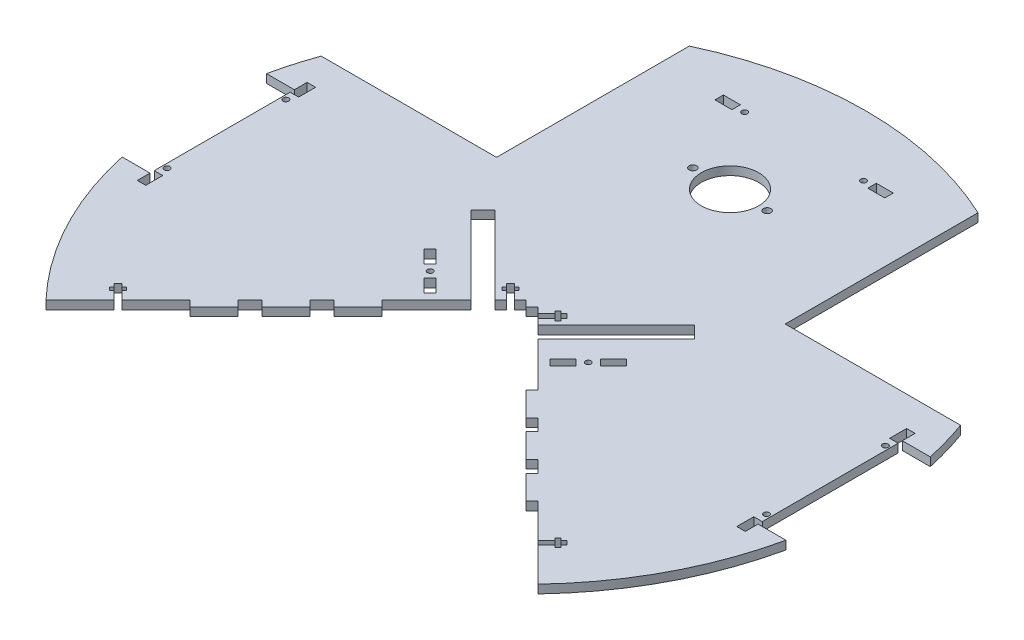
from build123d import *

# Parameters (mm, degrees)
SKETCH1_R                   = 254
BASE_PLATE_DEPTH            = 6.35
V_FUNNEL_CUT_DEPTH          = 360.266367059
SKETCH4_W                   = 26.67
SKETCH4_H                   = 107.95
WHEEL_HOLE_SLOT_DEPTH       = 360.266367059
SKETCH6_R                   = 2.0955
ARM_POST_CONNECTOR_DEPTH    = 356.188713046
SKETCH8_R                   = 2.1336
SKETCH8_W                   = 6.35
SKETCH8_H                   = 12.7
MOTOR_MOUNT_CONNECTOR_DEPTH = 356.188713046
SKETCH9_R                   = 2.1336
SKETCH9_W                   = 12.7
SKETCH9_H                   = 6.35
BACK_MOUNT_CONNECTOR_DEPTH  = 356.188713046
CUT_EXTRUDE2_DEPTH          = 356.188713046
SKETCH17_W                  = 164.760120997
SKETCH17_H                  = 168.221384869
CUT_EXTRUDE4_DEPTH          = 356.188713046
SKETCH11_R                  = 21.463
SKETCH11_R_2                = 2.778125
CASTER_WHEEL_HOLE_DEPTH     = 356.188713046
SKETCH12_W                  = 76.2
SKETCH12_H                  = 6.35
SKETCH12_W_2                = 12.7
V_FUNNEL_TABS_DEPTH         = 6.35
PEG_CLEARANCE_DEPTH         = 356.188713046
V_FUNNEL_T_SLOT_1_DEPTH     = 356.188713046
V_FUNNEL_T_SLOT_2_DEPTH     = 356.188713046


with BuildPart() as part:
    # Sketch1 → Base Plate (new body)
    with BuildSketch(Plane(origin=(0, 0, 0), x_dir=(1, 0, 0), z_dir=(0, 1, 0))):
        Circle(SKETCH1_R)
    extrude(amount=BASE_PLATE_DEPTH)

    # Sketch2 → V Funnel Cut (cut, through all)
    with BuildSketch(Plane(origin=(0, 6.35, 0), x_dir=(1, 0, 0), z_dir=(0, 1, 0))):
        with BuildLine():
            Line((0, 0), (-179.605122421, -179.605122421))
            ThreePointArc((-179.605122421, -179.605122421), (0, -254), (179.605122421, -179.605122421))
            Line((179.605122421, -179.605122421), (0, 0))
        make_face()
    extrude(amount=-V_FUNNEL_CUT_DEPTH, mode=Mode.SUBTRACT)

    # Sketch4 → Wheel Hole Slot (cut, through all)
    with BuildSketch(Plane(origin=(0, 6.35, 0), x_dir=(1, 0, 0), z_dir=(0, 1, 0))):
        with Locations((-240.665, 0)):
            Rectangle(SKETCH4_W, SKETCH4_H)
    wheel_hole_slot = extrude(amount=-WHEEL_HOLE_SLOT_DEPTH, mode=Mode.SUBTRACT)

    # Wheel Slot Mirror: Wheel Hole Slot across plane
    add(wheel_hole_slot.mirror(Plane(origin=(0, 0, 0), x_dir=(0, 0, 1), z_dir=(1, 0, 0))), mode=Mode.SUBTRACT)

    # Sketch6 → Arm Post Connector (cut, through all)
    with BuildSketch(Plane(origin=(0, 6.35, 0), x_dir=(1, 0, 0), z_dir=(0, 1, 0))):
        with Locations((-59.123400668, -12.718648301)):
            Circle(SKETCH6_R)
        Polygon((-61.368464698, -5.98345621), (-71.1004567, 3.748535792), (-75.59058476, -0.741592269), (-65.858592758, -10.473584271), align=None)
        Polygon((-52.388208577, -14.963712331), (-42.656216575, -24.695704333), (-47.146344636, -29.185832393), (-56.878336637, -19.453840392), align=None)
    arm_post_connector = extrude(amount=-ARM_POST_CONNECTOR_DEPTH, mode=Mode.SUBTRACT)

    # Arm Post Connector Mirror: Arm Post Connector across plane
    add(arm_post_connector.mirror(Plane(origin=(0, 0, 0), x_dir=(0, 0, 1), z_dir=(1, 0, 0))), mode=Mode.SUBTRACT)

    # Sketch8 → Motor Mount Connector (cut, through all)
    with BuildSketch(Plane.XZ):
        with Locations((-224.155, -44.45)):
            Circle(SKETCH8_R)
        with Locations((-224.155, 44.45)):
            Circle(SKETCH8_R)
        with Locations((-224.155, -57.15)):
            Rectangle(SKETCH8_W, SKETCH8_H)
        with Locations((-224.155, 57.15)):
            Rectangle(SKETCH8_W, SKETCH8_H)
    motor_mount_connector = extrude(amount=-MOTOR_MOUNT_CONNECTOR_DEPTH, mode=Mode.SUBTRACT)

    # Motor Mount Connector Mirror: Motor Mount Connector across plane
    add(motor_mount_connector.mirror(Plane(origin=(0, 0, 0), x_dir=(0, 0, 1), z_dir=(1, 0, 0))), mode=Mode.SUBTRACT)

    # Sketch9 → Back Mount Connector (cut, through all)
    with BuildSketch(Plane.XZ):
        with Locations((-44.45, -207.81727558)):
            Circle(SKETCH9_R)
        with Locations((44.45, -207.81727558)):
            Circle(SKETCH9_R)
        with Locations((-57.15, -207.81727558)):
            Rectangle(SKETCH9_W, SKETCH9_H)
        with Locations((57.15, -207.81727558)):
            Rectangle(SKETCH9_W, SKETCH9_H)
    extrude(amount=-BACK_MOUNT_CONNECTOR_DEPTH, mode=Mode.SUBTRACT)

    # Sketch16 → Cut-Extrude2 (cut, through all)
    with BuildSketch(Plane(origin=(0, 6.35, 0), x_dir=(1, 0, 0), z_dir=(0, 1, 0))):
        Polygon((20.669579742, -20.669579742), (79.044935611, 37.698393963), (71.816173913, 44.92715566), (13.444509127, -13.444509127), align=None)
        Polygon((-79.044935611, 37.698393963), (-71.816173913, 44.92715566), (-13.444509127, -13.444509127), (-20.669579742, -20.669579742), align=None)
    extrude(amount=-CUT_EXTRUDE2_DEPTH, mode=Mode.SUBTRACT)

    # Sketch17 → Cut-Extrude4 (cut, through all)
    with BuildSketch(Plane(origin=(0, 6.35, 0), x_dir=(1, 0, 0), z_dir=(0, 1, 0))):
        with Locations((-190.330685079, 169.889307566)):
            Rectangle(SKETCH17_W, SKETCH17_H)
        with Locations((190.330685079, 169.889307566)):
            Rectangle(SKETCH17_W, SKETCH17_H)
    extrude(amount=-CUT_EXTRUDE4_DEPTH, mode=Mode.SUBTRACT)

    # Sketch11 → Caster Wheel Hole (cut, through all)
    with BuildSketch(Plane(origin=(0, 6.35, 0), x_dir=(1, 0, 0), z_dir=(0, 1, 0))):
        with Locations((0, 152.4)):
            Circle(SKETCH11_R)
        with Locations((27.78125, 152.4)):
            Circle(SKETCH11_R_2)
        with Locations((-27.78125, 152.4)):
            Circle(SKETCH11_R_2)
    extrude(amount=-CASTER_WHEEL_HOLE_DEPTH, mode=Mode.SUBTRACT)

    # Sketch12 → V Funnel Tabs (cut)
    with BuildSketch(Plane(origin=(0, 0, 0), x_dir=(0.7071067811865489, 0, -0.7071067811865462), z_dir=(0.7071067811865462, 0, 0.7071067811865489))):
        with Locations((-215.9, 3.175)):
            Rectangle(SKETCH12_W, SKETCH12_H)
        with Locations((-146.05, 3.175)):
            Rectangle(SKETCH12_W_2, SKETCH12_H)
        with Locations((-107.95, 3.175)):
            Rectangle(SKETCH12_W_2, SKETCH12_H)
        with Locations((-38.1, 3.175)):
            Rectangle(SKETCH12_W, SKETCH12_H)
    v_funnel_tabs = extrude(amount=-V_FUNNEL_TABS_DEPTH, mode=Mode.SUBTRACT)

    # V Funnel Tab Mirror: V Funnel Tabs across plane
    add(v_funnel_tabs.mirror(Plane(origin=(0, 0, 0), x_dir=(0, 0, 1), z_dir=(1, 0, 0))), mode=Mode.SUBTRACT)

    # Sketch13 → Peg Clearance (cut, through all)
    with BuildSketch(Plane(origin=(0, 6.35, 0), x_dir=(1, 0, 0), z_dir=(0, 1, 0))):
        Polygon((-11.689323621, -11.689323621), (-20.669579742, -20.669579742), (-83.53137259, 42.192213105), (-74.551116468, 51.172469226), align=None)
    peg_clearance = extrude(amount=-PEG_CLEARANCE_DEPTH, mode=Mode.SUBTRACT)

    # Peg Clearance Mirror: Peg Clearance across plane
    add(peg_clearance.mirror(Plane(origin=(0, 0, 0), x_dir=(0, 0, 1), z_dir=(1, 0, 0))), mode=Mode.SUBTRACT)

    # Sketch14 → V Funnel T Slot 1 (cut, through all)
    with BuildSketch(Plane(origin=(0, 6.35, 0), x_dir=(1, 0, 0), z_dir=(0, 1, 0))):
        Polygon((-11.843472899, -2.863216778), (-8.826106843, 0.154149278), (-15.022483566, 6.350526002), (-13.388076952, 7.984932616), (-15.633140982, 10.229996646), (-17.267547597, 8.595590032), (-19.602414188, 10.930456624), (-22.619780245, 7.913090567), (-20.284913653, 5.578223975), (-21.919320267, 3.943817361), (-19.674256237, 1.698753331), (-18.039849623, 3.333159945), align=None)
    v_funnel_t_slot_1 = extrude(amount=-V_FUNNEL_T_SLOT_1_DEPTH, mode=Mode.SUBTRACT)

    # Sketch15 → V Funnel T Slot 2 (cut, through all)
    with BuildSketch(Plane(origin=(0, 6.35, 0), x_dir=(1, 0, 0), z_dir=(0, 1, 0))):
        Polygon((-158.663165147, -149.682909026), (-155.64579909, -146.665542969), (-161.842175814, -140.469166246), (-160.2077692, -138.834759632), (-162.45283323, -136.589695601), (-164.087239844, -138.224102215), (-166.422106436, -135.889235624), (-169.439472492, -138.906601681), (-167.104605901, -141.241468272), (-168.739012515, -142.875874886), (-166.493948485, -145.120938916), (-164.859541871, -143.486532302), align=None)
    v_funnel_t_slot_2 = extrude(amount=-V_FUNNEL_T_SLOT_2_DEPTH, mode=Mode.SUBTRACT)

    # Mirror1: V Funnel T Slot 1, V Funnel T Slot 2 across plane
    add(v_funnel_t_slot_1.mirror(Plane(origin=(0, 0, 0), x_dir=(0, 0, 1), z_dir=(1, 0, 0))), mode=Mode.SUBTRACT)
    add(v_funnel_t_slot_2.mirror(Plane(origin=(0, 0, 0), x_dir=(0, 0, 1), z_dir=(1, 0, 0))), mode=Mode.SUBTRACT)


solid = part.part
